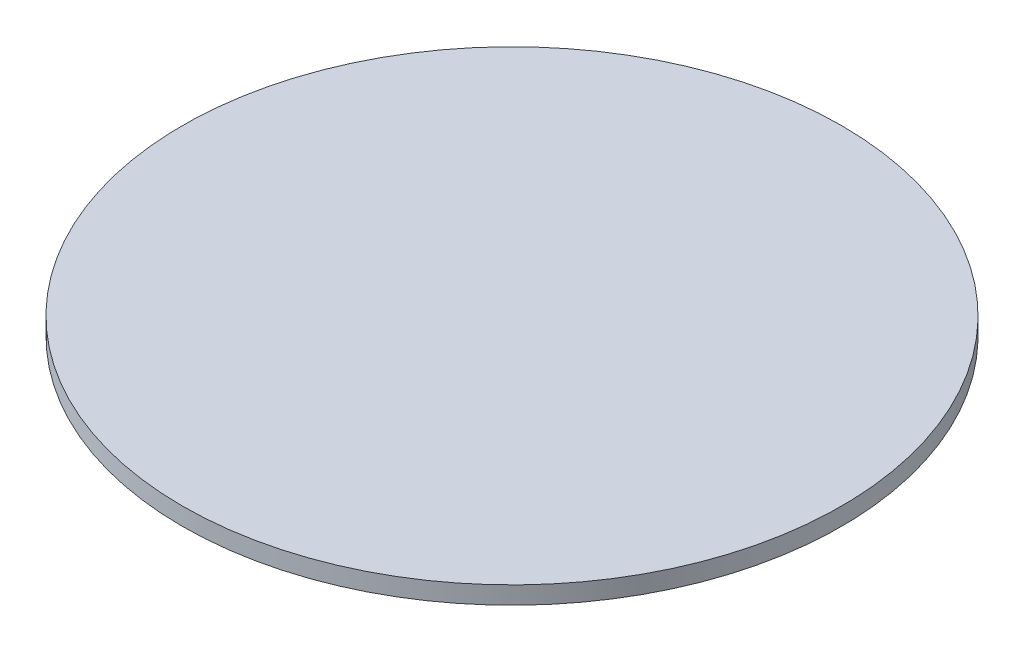
from build123d import *

# Parameters (mm, degrees)
SKETCH1_R                = 37.5
BOSS_EXTRUDE1_DEPTH      = 2
CUT_EXTRUDE1_OUTLINE_R   = 34.5
CUT_EXTRUDE1_OUTLINE_R_2 = 33.25
CUT_EXTRUDE1_OUTLINE_R_3 = 20.75
CUT_EXTRUDE1_OUTLINE_R_4 = 19.125
CUT_EXTRUDE1_OUTLINE_R_5 = 7
CUT_EXTRUDE1_OUTLINE_R_6 = 5.1
CUT_EXTRUDE1_DEPTH       = 0.4
SKETCH4_R                = 45.148665426
SKETCH4_R_2              = 37.375
CUT_EXTRUDE2_DEPTH       = 54.070707551


# Read off the part's stored shape, not the designer's step: Cut-Extrude1
with BuildPart() as part:
    # Sketch1 → Boss-Extrude1 (new body)
    with BuildSketch(Plane(origin=(0, 0, 0), x_dir=(1, 0, 0), z_dir=(0, 1, 0))):
        with Locations(Location((0, 0, 0), (0, 0, 270))):
            Circle(SKETCH1_R)
    extrude(amount=BOSS_EXTRUDE1_DEPTH)

    # Cut-Extrude1 outline → Cut-Extrude1 (cut)
    # profile 1 of 32: a face of its own
    with BuildSketch(Plane(origin=(0, 0, 0), x_dir=(1, 0, 0), z_dir=(0, 1, 0))):
        Circle(CUT_EXTRUDE1_OUTLINE_R)
        Circle(CUT_EXTRUDE1_OUTLINE_R_2, mode=Mode.SUBTRACT)
    # profile 2 of 32: a face of its own
    with BuildSketch(Plane(origin=(0, 0, 0), x_dir=(1, 0, 0), z_dir=(0, 1, 0))):
        with BuildLine():
            ThreePointArc((17.787271081, 14.244666107), (18.140824472, 14.098219498), (18.494377862, 14.244666107))
            add(Edge.make_bspline(
                [(18.494377862, 14.244666107), (18.773823334, 14.524111579), (19.892529947, 15.691578161), (21.619507812, 17.82365241), (23.140883452, 20.411675508), (23.625698704, 22.34072462), (23.249670965, 22.995112524)],
                knots=[0.045557158, 0.045557158, 0.045557158, 0.045557158, 0.155208161, 0.493865544, 0.798979995, 1, 1, 1, 1], degree=3))
            add(Edge.make_bspline(
                [(14.499224548, 18.239819421), (14.77867002, 18.519264892), (15.946136603, 19.637971506), (18.078210851, 21.364949371), (20.666233949, 22.886325011), (22.595283061, 23.371140262), (23.249670965, 22.995112524)],
                knots=[0.045557158, 0.045557158, 0.045557158, 0.045557158, 0.155208161, 0.493865544, 0.798979995, 1, 1, 1, 1], degree=3))
            ThreePointArc((14.499224548, 18.239819421), (14.352777939, 17.88626603), (14.499224548, 17.53271264))
            Line((14.499224548, 17.53271264), (15.436141033, 16.595796154))
            ThreePointArc((15.436141033, 16.595796154), (15.789694424, 16.449349545), (16.143247814, 16.595796154))
            Line((16.143247814, 16.595796154), (20.279822484, 20.732370824))
            ThreePointArc((20.279822484, 20.732370824), (20.986929265, 20.732370825), (20.986929266, 20.025264043))
            Line((20.986929266, 20.025264043), (16.850354596, 15.888689373))
            ThreePointArc((16.850354596, 15.888689373), (16.703907986, 15.535135982), (16.850354596, 15.181582592))
            Line((16.850354596, 15.181582592), (17.787271081, 14.244666107))
        make_face()
    # profile 3 of 32: a face of its own
    with BuildSketch(Plane(origin=(0, 0, 0), x_dir=(1, 0, 0), z_dir=(0, 1, 0))):
        with BuildLine():
            ThreePointArc((13.494393636, 18.362975396), (13.873803159, 18.313025184), (14.177406338, 18.545988098))
            add(Edge.make_bspline(
                [(14.177406338, 18.545988098), (14.375004126, 18.888237506), (15.153429151, 20.305466207), (16.269740251, 22.811866549), (17.069446606, 25.705465889), (17.038467529, 27.694263667), (16.505884573, 28.229030704)],
                knots=[0.045557158, 0.045557158, 0.045557158, 0.045557158, 0.155208161, 0.493865544, 0.798979995, 1, 1, 1, 1], degree=3))
            add(Edge.make_bspline(
                [(9.284362807, 21.370988098), (9.481960595, 21.713237506), (10.320104141, 23.095987702), (11.932554959, 25.315941645), (14.038632318, 27.455307333), (15.776471255, 28.422877555), (16.505884573, 28.229030704)],
                knots=[0.045557158, 0.045557158, 0.045557158, 0.045557158, 0.155208161, 0.493865544, 0.798979995, 1, 1, 1, 1], degree=3))
            ThreePointArc((9.284362807, 21.370988098), (9.234412596, 20.991578575), (9.467375509, 20.687975396))
            Line((9.467375509, 20.687975396), (10.614859169, 20.025475396))
            ThreePointArc((10.614859169, 20.025475396), (10.994268692, 19.975525184), (11.297871871, 20.208488098))
            Line((11.297871871, 20.208488098), (14.222871871, 25.27473671))
            ThreePointArc((14.222871871, 25.27473671), (14.905884573, 25.457749412), (15.088897275, 24.77473671))
            Line((15.088897275, 24.77473671), (12.163897275, 19.708488098))
            ThreePointArc((12.163897275, 19.708488098), (12.113947063, 19.329078575), (12.346909976, 19.025475396))
            Line((12.346909976, 19.025475396), (13.494393636, 18.362975396))
        make_face()
    # profile 4 of 32: a face of its own
    with BuildSketch(Plane(origin=(0, 0, 0), x_dir=(1, 0, 0), z_dir=(0, 1, 0))):
        with BuildLine():
            ThreePointArc((8.281895566, 21.229878257), (8.661305089, 21.279828469), (8.894268002, 21.583431648))
            add(Edge.make_bspline(
                [(8.894268002, 21.583431648), (8.996552144, 21.965161261), (9.381647199, 23.535570287), (9.811216778, 26.245489681), (9.834755182, 29.24747125), (9.290092949, 31.160484412), (8.637249424, 31.539187092)],
                knots=[0.045557158, 0.045557158, 0.045557158, 0.045557158, 0.155208161, 0.493865544, 0.798979995, 1, 1, 1, 1], degree=3))
            add(Edge.make_bspline(
                [(3.436787084, 23.045759253), (3.539071225, 23.427488866), (3.990773637, 24.980050504), (4.973715166, 27.541694332), (6.454321095, 30.153255833), (7.882519006, 31.537642713), (8.637249424, 31.539187092)],
                knots=[0.045557158, 0.045557158, 0.045557158, 0.045557158, 0.155208161, 0.493865544, 0.798979995, 1, 1, 1, 1], degree=3))
            ThreePointArc((3.436787084, 23.045759253), (3.486737295, 22.66634973), (3.790340474, 22.433386817))
            Line((3.790340474, 22.433386817), (5.070192194, 22.090451582))
            ThreePointArc((5.070192194, 22.090451582), (5.449601717, 22.140401794), (5.68256463, 22.444004973))
            Line((5.68256463, 22.444004973), (7.196656044, 28.094671057))
            ThreePointArc((7.196656044, 28.094671057), (7.809028479, 28.448224447), (8.16258187, 27.835852012))
            Line((8.16258187, 27.835852012), (6.648490456, 22.185185928))
            ThreePointArc((6.648490456, 22.185185928), (6.698440667, 21.805776405), (7.002043847, 21.572813492))
            Line((7.002043847, 21.572813492), (8.281895566, 21.229878257))
        make_face()
    # profile 5 of 32: a face of its own
    with BuildSketch(Plane(origin=(0, 0, 0), x_dir=(1, 0, 0), z_dir=(0, 1, 0))):
        with BuildLine():
            ThreePointArc((2.505, 22.65), (2.858553391, 22.796446609), (3.005, 23.15))
            add(Edge.make_bspline(
                [(3.005, 23.15), (3.005, 23.545195576), (2.970521495, 25.161764146), (2.684075096, 27.890526065), (1.929841445, 30.796309779), (0.908613888, 32.503169639), (0.18, 32.7)],
                knots=[0.045557158, 0.045557158, 0.045557158, 0.045557158, 0.155208161, 0.493865544, 0.798979995, 1, 1, 1, 1], degree=3))
            add(Edge.make_bspline(
                [(-2.645, 23.15), (-2.645, 23.545195576), (-2.610521495, 25.161764146), (-2.324075096, 27.890526065), (-1.569841445, 30.796309779), (-0.548613888, 32.503169639), (0.18, 32.7)],
                knots=[0.045557158, 0.045557158, 0.045557158, 0.045557158, 0.155208161, 0.493865544, 0.798979995, 1, 1, 1, 1], degree=3))
            ThreePointArc((-2.645, 23.15), (-2.498553391, 22.796446609), (-2.145, 22.65))
            Line((-2.145, 22.65), (-0.82, 22.65))
            ThreePointArc((-0.82, 22.65), (-0.466446609, 22.796446609), (-0.32, 23.15))
            Line((-0.32, 23.15), (-0.32, 29))
            ThreePointArc((-0.32, 29), (0.18, 29.5), (0.68, 29))
            Line((0.68, 29), (0.68, 23.15))
            ThreePointArc((0.68, 23.15), (0.826446609, 22.796446609), (1.18, 22.65))
            Line((1.18, 22.65), (2.505, 22.65))
        make_face()
    # profile 6 of 32: a face of its own
    with BuildSketch(Plane(origin=(0, 0, 0), x_dir=(1, 0, 0), z_dir=(0, 1, 0))):
        with BuildLine():
            ThreePointArc((22.526561673, 3.442607177), (22.759524586, 3.139003997), (23.138934109, 3.089053786))
            add(Edge.make_bspline(
                [(23.138934109, 3.089053786), (23.520663722, 3.191337928), (25.073225361, 3.64304034), (27.634869188, 4.625981869), (30.24643069, 6.106587798), (31.630817569, 7.534785708), (31.632361948, 8.289516126)],
                knots=[0.045557158, 0.045557158, 0.045557158, 0.045557158, 0.155208161, 0.493865544, 0.798979995, 1, 1, 1, 1], degree=3))
            add(Edge.make_bspline(
                [(21.676606504, 8.546534705), (22.058336118, 8.648818846), (23.628745143, 9.033913902), (26.338664538, 9.463483481), (29.340646106, 9.487021884), (31.253659268, 8.942359652), (31.632361948, 8.289516126)],
                knots=[0.045557158, 0.045557158, 0.045557158, 0.045557158, 0.155208161, 0.493865544, 0.798979995, 1, 1, 1, 1], degree=3))
            ThreePointArc((21.676606504, 8.546534705), (21.373003325, 8.313571792), (21.323053114, 7.934162269))
            Line((21.323053114, 7.934162269), (21.665988348, 6.654310549))
            ThreePointArc((21.665988348, 6.654310549), (21.898951262, 6.35070737), (22.278360784, 6.300757159))
            Line((22.278360784, 6.300757159), (27.929026868, 7.814848572))
            ThreePointArc((27.929026868, 7.814848572), (28.541399304, 7.461295182), (28.187845913, 6.848922746))
            Line((28.187845913, 6.848922746), (22.537179829, 5.334831332))
            ThreePointArc((22.537179829, 5.334831332), (22.23357665, 5.101868419), (22.183626439, 4.722458897))
            Line((22.183626439, 4.722458897), (22.526561673, 3.442607177))
        make_face()
    # profile 7 of 32: a face of its own
    with BuildSketch(Plane(origin=(0, 0, 0), x_dir=(1, 0, 0), z_dir=(0, 1, 0))):
        with BuildLine():
            ThreePointArc((20.867975396, 9.155606364), (21.171578575, 8.92264345), (21.550988098, 8.972593662))
            add(Edge.make_bspline(
                [(21.550988098, 8.972593662), (21.893237506, 9.17019145), (23.275987702, 10.008334996), (25.495941645, 11.620785814), (27.635307333, 13.726863173), (28.602877555, 15.46470211), (28.409030704, 16.194115427)],
                knots=[0.045557158, 0.045557158, 0.045557158, 0.045557158, 0.155208161, 0.493865544, 0.798979995, 1, 1, 1, 1], degree=3))
            add(Edge.make_bspline(
                [(18.725988098, 13.865637193), (19.068237506, 14.063234981), (20.485466207, 14.841660005), (22.991866549, 15.957971105), (25.885465889, 16.75767746), (27.874263667, 16.726698383), (28.409030704, 16.194115427)],
                knots=[0.045557158, 0.045557158, 0.045557158, 0.045557158, 0.155208161, 0.493865544, 0.798979995, 1, 1, 1, 1], degree=3))
            ThreePointArc((18.725988098, 13.865637193), (18.493025184, 13.562034014), (18.542975396, 13.182624491))
            Line((18.542975396, 13.182624491), (19.205475396, 12.035140831))
            ThreePointArc((19.205475396, 12.035140831), (19.509078575, 11.802177918), (19.888488098, 11.852128129))
            Line((19.888488098, 11.852128129), (24.95473671, 14.777128129))
            ThreePointArc((24.95473671, 14.777128129), (25.637749412, 14.594115427), (25.45473671, 13.911102725))
            Line((25.45473671, 13.911102725), (20.388488098, 10.986102725))
            ThreePointArc((20.388488098, 10.986102725), (20.155525184, 10.682499546), (20.205475396, 10.303090024))
            Line((20.205475396, 10.303090024), (20.867975396, 9.155606364))
        make_face()
    # profile 8 of 32: a face of its own
    with BuildSketch(Plane(origin=(0, 0, 0), x_dir=(1, 0, 0), z_dir=(0, 1, 0))):
        with BuildLine():
            ThreePointArc((22.65, -2.505), (22.796446609, -2.858553391), (23.15, -3.005))
            add(Edge.make_bspline(
                [(23.15, -3.005), (23.545195576, -3.005), (25.161764146, -2.970521495), (27.890526065, -2.684075096), (30.796309779, -1.929841445), (32.503169639, -0.908613888), (32.7, -0.18)],
                knots=[0.045557158, 0.045557158, 0.045557158, 0.045557158, 0.155208161, 0.493865544, 0.798979995, 1, 1, 1, 1], degree=3))
            add(Edge.make_bspline(
                [(23.15, 2.645), (23.545195576, 2.645), (25.161764146, 2.610521495), (27.890526065, 2.324075096), (30.796309779, 1.569841445), (32.503169639, 0.548613888), (32.7, -0.18)],
                knots=[0.045557158, 0.045557158, 0.045557158, 0.045557158, 0.155208161, 0.493865544, 0.798979995, 1, 1, 1, 1], degree=3))
            ThreePointArc((23.15, 2.645), (22.796446609, 2.498553391), (22.65, 2.145))
            Line((22.65, 2.145), (22.65, 0.82))
            ThreePointArc((22.65, 0.82), (22.796446609, 0.466446609), (23.15, 0.32))
            Line((23.15, 0.32), (29, 0.32))
            ThreePointArc((29, 0.32), (29.5, -0.18), (29, -0.68))
            Line((29, -0.68), (23.15, -0.68))
            ThreePointArc((23.15, -0.68), (22.796446609, -0.826446609), (22.65, -1.18))
            Line((22.65, -1.18), (22.65, -2.505))
        make_face()
    # profile 9 of 32: a face of its own
    with BuildSketch(Plane(origin=(0, 0, 0), x_dir=(1, 0, 0), z_dir=(0, 1, 0))):
        with BuildLine():
            ThreePointArc((21.229878257, -8.281895566), (21.279828469, -8.661305089), (21.583431648, -8.894268002))
            add(Edge.make_bspline(
                [(21.583431648, -8.894268002), (21.965161261, -8.996552144), (23.535570287, -9.381647199), (26.245489681, -9.811216778), (29.24747125, -9.834755182), (31.160484412, -9.290092949), (31.539187092, -8.637249424)],
                knots=[0.045557158, 0.045557158, 0.045557158, 0.045557158, 0.155208161, 0.493865544, 0.798979995, 1, 1, 1, 1], degree=3))
            add(Edge.make_bspline(
                [(23.045759253, -3.436787084), (23.427488866, -3.539071225), (24.980050504, -3.990773637), (27.541694332, -4.973715166), (30.153255833, -6.454321095), (31.537642713, -7.882519006), (31.539187092, -8.637249424)],
                knots=[0.045557158, 0.045557158, 0.045557158, 0.045557158, 0.155208161, 0.493865544, 0.798979995, 1, 1, 1, 1], degree=3))
            ThreePointArc((23.045759253, -3.436787084), (22.66634973, -3.486737295), (22.433386817, -3.790340474))
            Line((22.433386817, -3.790340474), (22.090451582, -5.070192194))
            ThreePointArc((22.090451582, -5.070192194), (22.140401794, -5.449601717), (22.444004973, -5.68256463))
            Line((22.444004973, -5.68256463), (28.094671057, -7.196656044))
            ThreePointArc((28.094671057, -7.196656044), (28.448224447, -7.809028479), (27.835852012, -8.16258187))
            Line((27.835852012, -8.16258187), (22.185185928, -6.648490456))
            ThreePointArc((22.185185928, -6.648490456), (21.805776405, -6.698440667), (21.572813492, -7.002043847))
            Line((21.572813492, -7.002043847), (21.229878257, -8.281895566))
        make_face()
    # profile 10 of 32: a face of its own
    with BuildSketch(Plane(origin=(0, 0, 0), x_dir=(1, 0, 0), z_dir=(0, 1, 0))):
        with BuildLine():
            ThreePointArc((-21.229878257, 8.281895566), (-21.279828469, 8.661305089), (-21.583431648, 8.894268002))
            add(Edge.make_bspline(
                [(-21.583431648, 8.894268002), (-21.965161261, 8.996552144), (-23.535570287, 9.381647199), (-26.245489681, 9.811216778), (-29.24747125, 9.834755182), (-31.160484412, 9.290092949), (-31.539187092, 8.637249424)],
                knots=[0.045557158, 0.045557158, 0.045557158, 0.045557158, 0.155208161, 0.493865544, 0.798979995, 1, 1, 1, 1], degree=3))
            add(Edge.make_bspline(
                [(-23.045759253, 3.436787084), (-23.427488866, 3.539071225), (-24.980050504, 3.990773637), (-27.541694332, 4.973715166), (-30.153255833, 6.454321095), (-31.537642713, 7.882519006), (-31.539187092, 8.637249424)],
                knots=[0.045557158, 0.045557158, 0.045557158, 0.045557158, 0.155208161, 0.493865544, 0.798979995, 1, 1, 1, 1], degree=3))
            ThreePointArc((-23.045759253, 3.436787084), (-22.66634973, 3.486737295), (-22.433386817, 3.790340474))
            Line((-22.433386817, 3.790340474), (-22.090451582, 5.070192194))
            ThreePointArc((-22.090451582, 5.070192194), (-22.140401794, 5.449601717), (-22.444004973, 5.68256463))
            Line((-22.444004973, 5.68256463), (-28.094671057, 7.196656044))
            ThreePointArc((-28.094671057, 7.196656044), (-28.448224447, 7.809028479), (-27.835852012, 8.16258187))
            Line((-27.835852012, 8.16258187), (-22.185185928, 6.648490456))
            ThreePointArc((-22.185185928, 6.648490456), (-21.805776405, 6.698440667), (-21.572813492, 7.002043847))
            Line((-21.572813492, 7.002043847), (-21.229878257, 8.281895566))
        make_face()
    # profile 11 of 32: a face of its own
    with BuildSketch(Plane(origin=(0, 0, 0), x_dir=(1, 0, 0), z_dir=(0, 1, 0))):
        with BuildLine():
            ThreePointArc((-22.65, 2.505), (-22.796446609, 2.858553391), (-23.15, 3.005))
            add(Edge.make_bspline(
                [(-23.15, 3.005), (-23.545195576, 3.005), (-25.161764146, 2.970521495), (-27.890526065, 2.684075096), (-30.796309779, 1.929841445), (-32.503169639, 0.908613888), (-32.7, 0.18)],
                knots=[0.045557158, 0.045557158, 0.045557158, 0.045557158, 0.155208161, 0.493865544, 0.798979995, 1, 1, 1, 1], degree=3))
            add(Edge.make_bspline(
                [(-23.15, -2.645), (-23.545195576, -2.645), (-25.161764146, -2.610521495), (-27.890526065, -2.324075096), (-30.796309779, -1.569841445), (-32.503169639, -0.548613888), (-32.7, 0.18)],
                knots=[0.045557158, 0.045557158, 0.045557158, 0.045557158, 0.155208161, 0.493865544, 0.798979995, 1, 1, 1, 1], degree=3))
            ThreePointArc((-23.15, -2.645), (-22.796446609, -2.498553391), (-22.65, -2.145))
            Line((-22.65, -2.145), (-22.65, -0.82))
            ThreePointArc((-22.65, -0.82), (-22.796446609, -0.466446609), (-23.15, -0.32))
            Line((-23.15, -0.32), (-29, -0.32))
            ThreePointArc((-29, -0.32), (-29.5, 0.18), (-29, 0.68))
            Line((-29, 0.68), (-23.15, 0.68))
            ThreePointArc((-23.15, 0.68), (-22.796446609, 0.826446609), (-22.65, 1.18))
            Line((-22.65, 1.18), (-22.65, 2.505))
        make_face()
    # profile 12 of 32: a face of its own
    with BuildSketch(Plane(origin=(0, 0, 0), x_dir=(1, 0, 0), z_dir=(0, 1, 0))):
        with BuildLine():
            ThreePointArc((-22.526561673, -3.442607177), (-22.759524586, -3.139003997), (-23.138934109, -3.089053786))
            add(Edge.make_bspline(
                [(-23.138934109, -3.089053786), (-23.520663722, -3.191337928), (-25.073225361, -3.64304034), (-27.634869188, -4.625981869), (-30.24643069, -6.106587798), (-31.630817569, -7.534785708), (-31.632361948, -8.289516126)],
                knots=[0.045557158, 0.045557158, 0.045557158, 0.045557158, 0.155208161, 0.493865544, 0.798979995, 1, 1, 1, 1], degree=3))
            add(Edge.make_bspline(
                [(-21.676606504, -8.546534705), (-22.058336118, -8.648818846), (-23.628745143, -9.033913902), (-26.338664538, -9.463483481), (-29.340646106, -9.487021884), (-31.253659268, -8.942359652), (-31.632361948, -8.289516126)],
                knots=[0.045557158, 0.045557158, 0.045557158, 0.045557158, 0.155208161, 0.493865544, 0.798979995, 1, 1, 1, 1], degree=3))
            ThreePointArc((-21.676606504, -8.546534705), (-21.373003325, -8.313571792), (-21.323053114, -7.934162269))
            Line((-21.323053114, -7.934162269), (-21.665988348, -6.654310549))
            ThreePointArc((-21.665988348, -6.654310549), (-21.898951262, -6.35070737), (-22.278360784, -6.300757159))
            Line((-22.278360784, -6.300757159), (-27.929026868, -7.814848572))
            ThreePointArc((-27.929026868, -7.814848572), (-28.541399304, -7.461295182), (-28.187845913, -6.848922746))
            Line((-28.187845913, -6.848922746), (-22.537179829, -5.334831332))
            ThreePointArc((-22.537179829, -5.334831332), (-22.23357665, -5.101868419), (-22.183626439, -4.722458897))
            Line((-22.183626439, -4.722458897), (-22.526561673, -3.442607177))
        make_face()
    # profile 13 of 32: a face of its own
    with BuildSketch(Plane(origin=(0, 0, 0), x_dir=(1, 0, 0), z_dir=(0, 1, 0))):
        with BuildLine():
            ThreePointArc((-9.155606364, 20.867975396), (-8.92264345, 21.171578575), (-8.972593662, 21.550988098))
            add(Edge.make_bspline(
                [(-8.972593662, 21.550988098), (-9.17019145, 21.893237506), (-10.008334996, 23.275987702), (-11.620785814, 25.495941645), (-13.726863173, 27.635307333), (-15.46470211, 28.602877555), (-16.194115427, 28.409030704)],
                knots=[0.045557158, 0.045557158, 0.045557158, 0.045557158, 0.155208161, 0.493865544, 0.798979995, 1, 1, 1, 1], degree=3))
            add(Edge.make_bspline(
                [(-13.865637193, 18.725988098), (-14.063234981, 19.068237506), (-14.841660005, 20.485466207), (-15.957971105, 22.991866549), (-16.75767746, 25.885465889), (-16.726698383, 27.874263667), (-16.194115427, 28.409030704)],
                knots=[0.045557158, 0.045557158, 0.045557158, 0.045557158, 0.155208161, 0.493865544, 0.798979995, 1, 1, 1, 1], degree=3))
            ThreePointArc((-13.865637193, 18.725988098), (-13.562034014, 18.493025184), (-13.182624491, 18.542975396))
            Line((-13.182624491, 18.542975396), (-12.035140831, 19.205475396))
            ThreePointArc((-12.035140831, 19.205475396), (-11.802177918, 19.509078575), (-11.852128129, 19.888488098))
            Line((-11.852128129, 19.888488098), (-14.777128129, 24.95473671))
            ThreePointArc((-14.777128129, 24.95473671), (-14.594115427, 25.637749412), (-13.911102725, 25.45473671))
            Line((-13.911102725, 25.45473671), (-10.986102725, 20.388488098))
            ThreePointArc((-10.986102725, 20.388488098), (-10.682499546, 20.155525184), (-10.303090024, 20.205475396))
            Line((-10.303090024, 20.205475396), (-9.155606364, 20.867975396))
        make_face()
    # profile 14 of 32: a face of its own
    with BuildSketch(Plane(origin=(0, 0, 0), x_dir=(1, 0, 0), z_dir=(0, 1, 0))):
        with BuildLine():
            ThreePointArc((-3.442607177, 22.526561673), (-3.139003997, 22.759524586), (-3.089053786, 23.138934109))
            add(Edge.make_bspline(
                [(-3.089053786, 23.138934109), (-3.191337928, 23.520663722), (-3.64304034, 25.073225361), (-4.625981869, 27.634869188), (-6.106587798, 30.24643069), (-7.534785708, 31.630817569), (-8.289516126, 31.632361948)],
                knots=[0.045557158, 0.045557158, 0.045557158, 0.045557158, 0.155208161, 0.493865544, 0.798979995, 1, 1, 1, 1], degree=3))
            add(Edge.make_bspline(
                [(-8.546534705, 21.676606504), (-8.648818846, 22.058336118), (-9.033913902, 23.628745143), (-9.463483481, 26.338664538), (-9.487021884, 29.340646106), (-8.942359652, 31.253659268), (-8.289516126, 31.632361948)],
                knots=[0.045557158, 0.045557158, 0.045557158, 0.045557158, 0.155208161, 0.493865544, 0.798979995, 1, 1, 1, 1], degree=3))
            ThreePointArc((-8.546534705, 21.676606504), (-8.313571792, 21.373003325), (-7.934162269, 21.323053114))
            Line((-7.934162269, 21.323053114), (-6.654310549, 21.665988348))
            ThreePointArc((-6.654310549, 21.665988348), (-6.35070737, 21.898951262), (-6.300757159, 22.278360784))
            Line((-6.300757159, 22.278360784), (-7.814848572, 27.929026868))
            ThreePointArc((-7.814848572, 27.929026868), (-7.461295182, 28.541399304), (-6.848922746, 28.187845913))
            Line((-6.848922746, 28.187845913), (-5.334831332, 22.537179829))
            ThreePointArc((-5.334831332, 22.537179829), (-5.101868419, 22.23357665), (-4.722458897, 22.183626439))
            Line((-4.722458897, 22.183626439), (-3.442607177, 22.526561673))
        make_face()
    # profile 15 of 32: a face of its own
    with BuildSketch(Plane(origin=(0, 0, 0), x_dir=(1, 0, 0), z_dir=(0, 1, 0))):
        with BuildLine():
            ThreePointArc((-18.362975396, 13.494393636), (-18.313025184, 13.873803159), (-18.545988098, 14.177406338))
            add(Edge.make_bspline(
                [(-18.545988098, 14.177406338), (-18.888237506, 14.375004126), (-20.305466207, 15.153429151), (-22.811866549, 16.269740251), (-25.705465889, 17.069446606), (-27.694263667, 17.038467529), (-28.229030704, 16.505884573)],
                knots=[0.045557158, 0.045557158, 0.045557158, 0.045557158, 0.155208161, 0.493865544, 0.798979995, 1, 1, 1, 1], degree=3))
            add(Edge.make_bspline(
                [(-21.370988098, 9.284362807), (-21.713237506, 9.481960595), (-23.095987702, 10.320104141), (-25.315941645, 11.932554959), (-27.455307333, 14.038632318), (-28.422877555, 15.776471255), (-28.229030704, 16.505884573)],
                knots=[0.045557158, 0.045557158, 0.045557158, 0.045557158, 0.155208161, 0.493865544, 0.798979995, 1, 1, 1, 1], degree=3))
            ThreePointArc((-21.370988098, 9.284362807), (-20.991578575, 9.234412596), (-20.687975396, 9.467375509))
            Line((-20.687975396, 9.467375509), (-20.025475396, 10.614859169))
            ThreePointArc((-20.025475396, 10.614859169), (-19.975525184, 10.994268692), (-20.208488098, 11.297871871))
            Line((-20.208488098, 11.297871871), (-25.27473671, 14.222871871))
            ThreePointArc((-25.27473671, 14.222871871), (-25.457749412, 14.905884573), (-24.77473671, 15.088897275))
            Line((-24.77473671, 15.088897275), (-19.708488098, 12.163897275))
            ThreePointArc((-19.708488098, 12.163897275), (-19.329078575, 12.113947063), (-19.025475396, 12.346909976))
            Line((-19.025475396, 12.346909976), (-18.362975396, 13.494393636))
        make_face()
    # profile 16 of 32: a face of its own
    with BuildSketch(Plane(origin=(0, 0, 0), x_dir=(1, 0, 0), z_dir=(0, 1, 0))):
        with BuildLine():
            ThreePointArc((-14.244666107, 17.787271081), (-14.098219498, 18.140824472), (-14.244666107, 18.494377862))
            add(Edge.make_bspline(
                [(-14.244666107, 18.494377862), (-14.524111579, 18.773823334), (-15.691578161, 19.892529947), (-17.82365241, 21.619507812), (-20.411675508, 23.140883452), (-22.34072462, 23.625698704), (-22.995112524, 23.249670965)],
                knots=[0.045557158, 0.045557158, 0.045557158, 0.045557158, 0.155208161, 0.493865544, 0.798979995, 1, 1, 1, 1], degree=3))
            add(Edge.make_bspline(
                [(-18.239819421, 14.499224548), (-18.519264892, 14.77867002), (-19.637971506, 15.946136603), (-21.364949371, 18.078210851), (-22.886325011, 20.666233949), (-23.371140262, 22.595283061), (-22.995112524, 23.249670965)],
                knots=[0.045557158, 0.045557158, 0.045557158, 0.045557158, 0.155208161, 0.493865544, 0.798979995, 1, 1, 1, 1], degree=3))
            ThreePointArc((-18.239819421, 14.499224548), (-17.88626603, 14.352777939), (-17.53271264, 14.499224548))
            Line((-17.53271264, 14.499224548), (-16.595796154, 15.436141033))
            ThreePointArc((-16.595796154, 15.436141033), (-16.449349545, 15.789694424), (-16.595796154, 16.143247814))
            Line((-16.595796154, 16.143247814), (-20.732370824, 20.279822484))
            ThreePointArc((-20.732370824, 20.279822484), (-20.732370825, 20.986929265), (-20.025264043, 20.986929266))
            Line((-20.025264043, 20.986929266), (-15.888689373, 16.850354596))
            ThreePointArc((-15.888689373, 16.850354596), (-15.535135982, 16.703907986), (-15.181582592, 16.850354596))
            Line((-15.181582592, 16.850354596), (-14.244666107, 17.787271081))
        make_face()
    # profile 17 of 32: a face of its own
    with BuildSketch(Plane(origin=(0, 0, 0), x_dir=(1, 0, 0), z_dir=(0, 1, 0))):
        with BuildLine():
            ThreePointArc((-2.505, -22.65), (-2.858553391, -22.796446609), (-3.005, -23.15))
            add(Edge.make_bspline(
                [(-3.005, -23.15), (-3.005, -23.545195576), (-2.970521495, -25.161764146), (-2.684075096, -27.890526065), (-1.929841445, -30.796309779), (-0.908613888, -32.503169639), (-0.18, -32.7)],
                knots=[0.045557158, 0.045557158, 0.045557158, 0.045557158, 0.155208161, 0.493865544, 0.798979995, 1, 1, 1, 1], degree=3))
            add(Edge.make_bspline(
                [(2.645, -23.15), (2.645, -23.545195576), (2.610521495, -25.161764146), (2.324075096, -27.890526065), (1.569841445, -30.796309779), (0.548613888, -32.503169639), (-0.18, -32.7)],
                knots=[0.045557158, 0.045557158, 0.045557158, 0.045557158, 0.155208161, 0.493865544, 0.798979995, 1, 1, 1, 1], degree=3))
            ThreePointArc((2.645, -23.15), (2.498553391, -22.796446609), (2.145, -22.65))
            Line((2.145, -22.65), (0.82, -22.65))
            ThreePointArc((0.82, -22.65), (0.466446609, -22.796446609), (0.32, -23.15))
            Line((0.32, -23.15), (0.32, -29))
            ThreePointArc((0.32, -29), (-0.18, -29.5), (-0.68, -29))
            Line((-0.68, -29), (-0.68, -23.15))
            ThreePointArc((-0.68, -23.15), (-0.826446609, -22.796446609), (-1.18, -22.65))
            Line((-1.18, -22.65), (-2.505, -22.65))
        make_face()
    # profile 18 of 32: a face of its own
    with BuildSketch(Plane(origin=(0, 0, 0), x_dir=(1, 0, 0), z_dir=(0, 1, 0))):
        with BuildLine():
            ThreePointArc((-8.281895566, -21.229878257), (-8.661305089, -21.279828469), (-8.894268002, -21.583431648))
            add(Edge.make_bspline(
                [(-8.894268002, -21.583431648), (-8.996552144, -21.965161261), (-9.381647199, -23.535570287), (-9.811216778, -26.245489681), (-9.834755182, -29.24747125), (-9.290092949, -31.160484412), (-8.637249424, -31.539187092)],
                knots=[0.045557158, 0.045557158, 0.045557158, 0.045557158, 0.155208161, 0.493865544, 0.798979995, 1, 1, 1, 1], degree=3))
            add(Edge.make_bspline(
                [(-3.436787084, -23.045759253), (-3.539071225, -23.427488866), (-3.990773637, -24.980050504), (-4.973715166, -27.541694332), (-6.454321095, -30.153255833), (-7.882519006, -31.537642713), (-8.637249424, -31.539187092)],
                knots=[0.045557158, 0.045557158, 0.045557158, 0.045557158, 0.155208161, 0.493865544, 0.798979995, 1, 1, 1, 1], degree=3))
            ThreePointArc((-3.436787084, -23.045759253), (-3.486737295, -22.66634973), (-3.790340474, -22.433386817))
            Line((-3.790340474, -22.433386817), (-5.070192194, -22.090451582))
            ThreePointArc((-5.070192194, -22.090451582), (-5.449601717, -22.140401794), (-5.68256463, -22.444004973))
            Line((-5.68256463, -22.444004973), (-7.196656044, -28.094671057))
            ThreePointArc((-7.196656044, -28.094671057), (-7.809028479, -28.448224447), (-8.16258187, -27.835852012))
            Line((-8.16258187, -27.835852012), (-6.648490456, -22.185185928))
            ThreePointArc((-6.648490456, -22.185185928), (-6.698440667, -21.805776405), (-7.002043847, -21.572813492))
            Line((-7.002043847, -21.572813492), (-8.281895566, -21.229878257))
        make_face()
    # profile 19 of 32: a face of its own
    with BuildSketch(Plane(origin=(0, 0, 0), x_dir=(1, 0, 0), z_dir=(0, 1, 0))):
        with BuildLine():
            ThreePointArc((-17.787271081, -14.244666107), (-18.140824472, -14.098219498), (-18.494377862, -14.244666107))
            add(Edge.make_bspline(
                [(-18.494377862, -14.244666107), (-18.773823334, -14.524111579), (-19.892529947, -15.691578161), (-21.619507812, -17.82365241), (-23.140883452, -20.411675508), (-23.625698704, -22.34072462), (-23.249670965, -22.995112524)],
                knots=[0.045557158, 0.045557158, 0.045557158, 0.045557158, 0.155208161, 0.493865544, 0.798979995, 1, 1, 1, 1], degree=3))
            add(Edge.make_bspline(
                [(-14.499224548, -18.239819421), (-14.77867002, -18.519264892), (-15.946136603, -19.637971506), (-18.078210851, -21.364949371), (-20.666233949, -22.886325011), (-22.595283061, -23.371140262), (-23.249670965, -22.995112524)],
                knots=[0.045557158, 0.045557158, 0.045557158, 0.045557158, 0.155208161, 0.493865544, 0.798979995, 1, 1, 1, 1], degree=3))
            ThreePointArc((-14.499224548, -18.239819421), (-14.352777939, -17.88626603), (-14.499224548, -17.53271264))
            Line((-14.499224548, -17.53271264), (-15.436141033, -16.595796154))
            ThreePointArc((-15.436141033, -16.595796154), (-15.789694424, -16.449349545), (-16.143247814, -16.595796154))
            Line((-16.143247814, -16.595796154), (-20.279822484, -20.732370824))
            ThreePointArc((-20.279822484, -20.732370824), (-20.986929265, -20.732370825), (-20.986929266, -20.025264043))
            Line((-20.986929266, -20.025264043), (-16.850354596, -15.888689373))
            ThreePointArc((-16.850354596, -15.888689373), (-16.703907986, -15.535135982), (-16.850354596, -15.181582592))
            Line((-16.850354596, -15.181582592), (-17.787271081, -14.244666107))
        make_face()
    # profile 20 of 32: a face of its own
    with BuildSketch(Plane(origin=(0, 0, 0), x_dir=(1, 0, 0), z_dir=(0, 1, 0))):
        with BuildLine():
            ThreePointArc((-13.494393636, -18.362975396), (-13.873803159, -18.313025184), (-14.177406338, -18.545988098))
            add(Edge.make_bspline(
                [(-14.177406338, -18.545988098), (-14.375004126, -18.888237506), (-15.153429151, -20.305466207), (-16.269740251, -22.811866549), (-17.069446606, -25.705465889), (-17.038467529, -27.694263667), (-16.505884573, -28.229030704)],
                knots=[0.045557158, 0.045557158, 0.045557158, 0.045557158, 0.155208161, 0.493865544, 0.798979995, 1, 1, 1, 1], degree=3))
            add(Edge.make_bspline(
                [(-9.284362807, -21.370988098), (-9.481960595, -21.713237506), (-10.320104141, -23.095987702), (-11.932554959, -25.315941645), (-14.038632318, -27.455307333), (-15.776471255, -28.422877555), (-16.505884573, -28.229030704)],
                knots=[0.045557158, 0.045557158, 0.045557158, 0.045557158, 0.155208161, 0.493865544, 0.798979995, 1, 1, 1, 1], degree=3))
            ThreePointArc((-9.284362807, -21.370988098), (-9.234412596, -20.991578575), (-9.467375509, -20.687975396))
            Line((-9.467375509, -20.687975396), (-10.614859169, -20.025475396))
            ThreePointArc((-10.614859169, -20.025475396), (-10.994268692, -19.975525184), (-11.297871871, -20.208488098))
            Line((-11.297871871, -20.208488098), (-14.222871871, -25.27473671))
            ThreePointArc((-14.222871871, -25.27473671), (-14.905884573, -25.457749412), (-15.088897275, -24.77473671))
            Line((-15.088897275, -24.77473671), (-12.163897275, -19.708488098))
            ThreePointArc((-12.163897275, -19.708488098), (-12.113947063, -19.329078575), (-12.346909976, -19.025475396))
            Line((-12.346909976, -19.025475396), (-13.494393636, -18.362975396))
        make_face()
    # profile 21 of 32: a face of its own
    with BuildSketch(Plane(origin=(0, 0, 0), x_dir=(1, 0, 0), z_dir=(0, 1, 0))):
        with BuildLine():
            ThreePointArc((14.244666107, -17.787271081), (14.098219498, -18.140824472), (14.244666107, -18.494377862))
            add(Edge.make_bspline(
                [(14.244666107, -18.494377862), (14.524111579, -18.773823334), (15.691578161, -19.892529947), (17.82365241, -21.619507812), (20.411675508, -23.140883452), (22.34072462, -23.625698704), (22.995112524, -23.249670965)],
                knots=[0.045557158, 0.045557158, 0.045557158, 0.045557158, 0.155208161, 0.493865544, 0.798979995, 1, 1, 1, 1], degree=3))
            add(Edge.make_bspline(
                [(18.239819421, -14.499224548), (18.519264892, -14.77867002), (19.637971506, -15.946136603), (21.364949371, -18.078210851), (22.886325011, -20.666233949), (23.371140262, -22.595283061), (22.995112524, -23.249670965)],
                knots=[0.045557158, 0.045557158, 0.045557158, 0.045557158, 0.155208161, 0.493865544, 0.798979995, 1, 1, 1, 1], degree=3))
            ThreePointArc((18.239819421, -14.499224548), (17.88626603, -14.352777939), (17.53271264, -14.499224548))
            Line((17.53271264, -14.499224548), (16.595796154, -15.436141033))
            ThreePointArc((16.595796154, -15.436141033), (16.449349545, -15.789694424), (16.595796154, -16.143247814))
            Line((16.595796154, -16.143247814), (20.732370824, -20.279822484))
            ThreePointArc((20.732370824, -20.279822484), (20.732370825, -20.986929265), (20.025264043, -20.986929266))
            Line((20.025264043, -20.986929266), (15.888689373, -16.850354596))
            ThreePointArc((15.888689373, -16.850354596), (15.535135982, -16.703907986), (15.181582592, -16.850354596))
            Line((15.181582592, -16.850354596), (14.244666107, -17.787271081))
        make_face()
    # profile 22 of 32: a face of its own
    with BuildSketch(Plane(origin=(0, 0, 0), x_dir=(1, 0, 0), z_dir=(0, 1, 0))):
        with BuildLine():
            ThreePointArc((18.362975396, -13.494393636), (18.313025184, -13.873803159), (18.545988098, -14.177406338))
            add(Edge.make_bspline(
                [(18.545988098, -14.177406338), (18.888237506, -14.375004126), (20.305466207, -15.153429151), (22.811866549, -16.269740251), (25.705465889, -17.069446606), (27.694263667, -17.038467529), (28.229030704, -16.505884573)],
                knots=[0.045557158, 0.045557158, 0.045557158, 0.045557158, 0.155208161, 0.493865544, 0.798979995, 1, 1, 1, 1], degree=3))
            add(Edge.make_bspline(
                [(21.370988098, -9.284362807), (21.713237506, -9.481960595), (23.095987702, -10.320104141), (25.315941645, -11.932554959), (27.455307333, -14.038632318), (28.422877555, -15.776471255), (28.229030704, -16.505884573)],
                knots=[0.045557158, 0.045557158, 0.045557158, 0.045557158, 0.155208161, 0.493865544, 0.798979995, 1, 1, 1, 1], degree=3))
            ThreePointArc((21.370988098, -9.284362807), (20.991578575, -9.234412596), (20.687975396, -9.467375509))
            Line((20.687975396, -9.467375509), (20.025475396, -10.614859169))
            ThreePointArc((20.025475396, -10.614859169), (19.975525184, -10.994268692), (20.208488098, -11.297871871))
            Line((20.208488098, -11.297871871), (25.27473671, -14.222871871))
            ThreePointArc((25.27473671, -14.222871871), (25.457749412, -14.905884573), (24.77473671, -15.088897275))
            Line((24.77473671, -15.088897275), (19.708488098, -12.163897275))
            ThreePointArc((19.708488098, -12.163897275), (19.329078575, -12.113947063), (19.025475396, -12.346909976))
            Line((19.025475396, -12.346909976), (18.362975396, -13.494393636))
        make_face()
    # profile 23 of 32: a face of its own
    with BuildSketch(Plane(origin=(0, 0, 0), x_dir=(1, 0, 0), z_dir=(0, 1, 0))):
        with BuildLine():
            ThreePointArc((3.442607177, -22.526561673), (3.139003997, -22.759524586), (3.089053786, -23.138934109))
            add(Edge.make_bspline(
                [(3.089053786, -23.138934109), (3.191337928, -23.520663722), (3.64304034, -25.073225361), (4.625981869, -27.634869188), (6.106587798, -30.24643069), (7.534785708, -31.630817569), (8.289516126, -31.632361948)],
                knots=[0.045557158, 0.045557158, 0.045557158, 0.045557158, 0.155208161, 0.493865544, 0.798979995, 1, 1, 1, 1], degree=3))
            add(Edge.make_bspline(
                [(8.546534705, -21.676606504), (8.648818846, -22.058336118), (9.033913902, -23.628745143), (9.463483481, -26.338664538), (9.487021884, -29.340646106), (8.942359652, -31.253659268), (8.289516126, -31.632361948)],
                knots=[0.045557158, 0.045557158, 0.045557158, 0.045557158, 0.155208161, 0.493865544, 0.798979995, 1, 1, 1, 1], degree=3))
            ThreePointArc((8.546534705, -21.676606504), (8.313571792, -21.373003325), (7.934162269, -21.323053114))
            Line((7.934162269, -21.323053114), (6.654310549, -21.665988348))
            ThreePointArc((6.654310549, -21.665988348), (6.35070737, -21.898951262), (6.300757159, -22.278360784))
            Line((6.300757159, -22.278360784), (7.814848572, -27.929026868))
            ThreePointArc((7.814848572, -27.929026868), (7.461295182, -28.541399304), (6.848922746, -28.187845913))
            Line((6.848922746, -28.187845913), (5.334831332, -22.537179829))
            ThreePointArc((5.334831332, -22.537179829), (5.101868419, -22.23357665), (4.722458897, -22.183626439))
            Line((4.722458897, -22.183626439), (3.442607177, -22.526561673))
        make_face()
    # profile 24 of 32: a face of its own
    with BuildSketch(Plane(origin=(0, 0, 0), x_dir=(1, 0, 0), z_dir=(0, 1, 0))):
        with BuildLine():
            ThreePointArc((9.155606364, -20.867975396), (8.92264345, -21.171578575), (8.972593662, -21.550988098))
            add(Edge.make_bspline(
                [(8.972593662, -21.550988098), (9.17019145, -21.893237506), (10.008334996, -23.275987702), (11.620785814, -25.495941645), (13.726863173, -27.635307333), (15.46470211, -28.602877555), (16.194115427, -28.409030704)],
                knots=[0.045557158, 0.045557158, 0.045557158, 0.045557158, 0.155208161, 0.493865544, 0.798979995, 1, 1, 1, 1], degree=3))
            add(Edge.make_bspline(
                [(13.865637193, -18.725988098), (14.063234981, -19.068237506), (14.841660005, -20.485466207), (15.957971105, -22.991866549), (16.75767746, -25.885465889), (16.726698383, -27.874263667), (16.194115427, -28.409030704)],
                knots=[0.045557158, 0.045557158, 0.045557158, 0.045557158, 0.155208161, 0.493865544, 0.798979995, 1, 1, 1, 1], degree=3))
            ThreePointArc((13.865637193, -18.725988098), (13.562034014, -18.493025184), (13.182624491, -18.542975396))
            Line((13.182624491, -18.542975396), (12.035140831, -19.205475396))
            ThreePointArc((12.035140831, -19.205475396), (11.802177918, -19.509078575), (11.852128129, -19.888488098))
            Line((11.852128129, -19.888488098), (14.777128129, -24.95473671))
            ThreePointArc((14.777128129, -24.95473671), (14.594115427, -25.637749412), (13.911102725, -25.45473671))
            Line((13.911102725, -25.45473671), (10.986102725, -20.388488098))
            ThreePointArc((10.986102725, -20.388488098), (10.682499546, -20.155525184), (10.303090024, -20.205475396))
            Line((10.303090024, -20.205475396), (9.155606364, -20.867975396))
        make_face()
    # profile 25 of 32: a face of its own
    with BuildSketch(Plane(origin=(0, 0, 0), x_dir=(1, 0, 0), z_dir=(0, 1, 0))):
        with BuildLine():
            ThreePointArc((-20.867975396, -9.155606364), (-21.171578575, -8.92264345), (-21.550988098, -8.972593662))
            add(Edge.make_bspline(
                [(-21.550988098, -8.972593662), (-21.893237506, -9.17019145), (-23.275987702, -10.008334996), (-25.495941645, -11.620785814), (-27.635307333, -13.726863173), (-28.602877555, -15.46470211), (-28.409030704, -16.194115427)],
                knots=[0.045557158, 0.045557158, 0.045557158, 0.045557158, 0.155208161, 0.493865544, 0.798979995, 1, 1, 1, 1], degree=3))
            add(Edge.make_bspline(
                [(-18.725988098, -13.865637193), (-19.068237506, -14.063234981), (-20.485466207, -14.841660005), (-22.991866549, -15.957971105), (-25.885465889, -16.75767746), (-27.874263667, -16.726698383), (-28.409030704, -16.194115427)],
                knots=[0.045557158, 0.045557158, 0.045557158, 0.045557158, 0.155208161, 0.493865544, 0.798979995, 1, 1, 1, 1], degree=3))
            ThreePointArc((-18.725988098, -13.865637193), (-18.493025184, -13.562034014), (-18.542975396, -13.182624491))
            Line((-18.542975396, -13.182624491), (-19.205475396, -12.035140831))
            ThreePointArc((-19.205475396, -12.035140831), (-19.509078575, -11.802177918), (-19.888488098, -11.852128129))
            Line((-19.888488098, -11.852128129), (-24.95473671, -14.777128129))
            ThreePointArc((-24.95473671, -14.777128129), (-25.637749412, -14.594115427), (-25.45473671, -13.911102725))
            Line((-25.45473671, -13.911102725), (-20.388488098, -10.986102725))
            ThreePointArc((-20.388488098, -10.986102725), (-20.155525184, -10.682499546), (-20.205475396, -10.303090024))
            Line((-20.205475396, -10.303090024), (-20.867975396, -9.155606364))
        make_face()
    # profile 26 of 32: a face of its own
    with BuildSketch(Plane(origin=(0, 0, 0), x_dir=(1, 0, 0), z_dir=(0, 1, 0))):
        Circle(CUT_EXTRUDE1_OUTLINE_R_3)
        Circle(CUT_EXTRUDE1_OUTLINE_R_4, mode=Mode.SUBTRACT)
    # profile 27 of 32: a face of its own
    with BuildSketch(Plane(origin=(0, 0, 0), x_dir=(1, 0, 0), z_dir=(0, 1, 0))):
        with BuildLine():
            ThreePointArc((6.204425411, 9.980045178), (6.519885642, 10.408422387), (6.81211793, 10.852969887))
            Line((6.81211793, 10.852969887), (7.318822352, 11.67034426))
            ThreePointArc((7.318822352, 11.67034426), (7.381529561, 11.823453898), (7.39083691, 11.988645085))
            ThreePointArc((7.39083691, 11.988645085), (8.082928526, 13.340477064), (9.598053982, 13.236384046))
            ThreePointArc((9.598053982, 13.236384046), (10.145899606, 11.819942845), (9.059460239, 10.758768963))
            ThreePointArc((9.059460239, 10.758768963), (8.904424141, 10.700988661), (8.776732546, 10.59577644))
            Line((8.776732546, 10.59577644), (8.145940209, 9.86986235))
            ThreePointArc((8.145940209, 9.86986235), (7.807797185, 9.459153834), (7.491974563, 9.03104373))
            Line((7.491974563, 9.03104373), (5.195162215, 5.737716427))
            ThreePointArc((5.195162215, 5.737716427), (5.234457094, 5.268422995), (5.702935083, 5.220373162))
            Line((5.702935083, 5.220373162), (10.155124076, 8.203405632))
            ThreePointArc((10.155124076, 8.203405632), (10.286742404, 8.245600896), (10.420664733, 8.211415605))
            ThreePointArc((10.420664733, 8.211415605), (10.643591852, 8.015612938), (10.777616107, 7.750900483))
            ThreePointArc((10.777616107, 7.750900483), (10.775105908, 7.605443783), (10.692039492, 7.486012115))
            Line((10.692039492, 7.486012115), (6.655897648, 4.302392379))
            ThreePointArc((6.655897648, 4.302392379), (6.480039883, 4.029310715), (6.509067148, 3.705803425))
            Line((6.509067148, 3.705803425), (6.727270107, 3.21757291))
            ThreePointArc((6.727270107, 3.21757291), (6.99045577, 2.960463392), (7.358310357, 2.95304714))
            Line((7.358310357, 2.95304714), (13.22662951, 5.139303332))
            ThreePointArc((13.22662951, 5.139303332), (14.39558022, 6.340934968), (14.53072176, 8.011893111))
            ThreePointArc((14.53072176, 8.011893111), (13.330380192, 11.791053673), (10.755009059, 14.806072407))
            ThreePointArc((10.755009059, 14.806072407), (7.112855971, 16.37374435), (3.14774746, 16.401832312))
            ThreePointArc((3.14774746, 16.401832312), (1.591643913, 15.778208945), (0.789807011, 14.305992272))
            Line((0.789807011, 14.305992272), (0.438279492, 8.053527621))
            ThreePointArc((0.438279492, 8.053527621), (0.554233596, 7.704347662), (0.877717049, 7.529046627))
            Line((0.877717049, 7.529046627), (1.408654322, 7.465115568))
            ThreePointArc((1.408654322, 7.465115568), (1.726259531, 7.5331338), (1.935060468, 7.781934358))
            Line((1.935060468, 7.781934358), (3.781520565, 12.579481723))
            ThreePointArc((3.781520565, 12.579481723), (3.871017446, 12.69417375), (4.009214836, 12.7396208))
            ThreePointArc((4.009214836, 12.7396208), (4.301734058, 12.689944963), (4.554742276, 12.534954556))
            ThreePointArc((4.554742276, 12.534954556), (4.627031682, 12.417149351), (4.625680454, 12.278939371))
            Line((4.625680454, 12.278939371), (3.093954552, 7.143349307))
            ThreePointArc((3.093954552, 7.143349307), (3.278502333, 6.710079727), (3.738401331, 6.811437136))
            Line((3.738401331, 6.811437136), (6.204425411, 9.980045178))
        make_face()
    # profile 28 of 32: a face of its own
    with BuildSketch(Plane(origin=(0, 0, 0), x_dir=(1, 0, 0), z_dir=(0, 1, 0))):
        with BuildLine():
            ThreePointArc((-7.574314107, 8.984762782), (-7.884242471, 9.417159127), (-8.216727524, 9.832461282))
            Line((-8.216727524, 9.832461282), (-8.837516471, 10.566948396))
            ThreePointArc((-8.837516471, 10.566948396), (-8.963754796, 10.673899976), (-9.117984822, 10.733798675))
            ThreePointArc((-9.117984822, 10.733798675), (-10.189785364, 11.809755971), (-9.622587506, 13.218559398))
            ThreePointArc((-9.622587506, 13.218559398), (-8.106178263, 13.301887146), (-7.432670156, 11.940701143))
            ThreePointArc((-7.432670156, 11.940701143), (-7.425626612, 11.775397956), (-7.365022716, 11.621443668))
            Line((-7.365022716, 11.621443668), (-6.869562943, 10.797204715))
            ThreePointArc((-6.869562943, 10.797204715), (-6.583447873, 10.348695678), (-6.273885527, 9.916037217))
            Line((-6.273885527, 9.916037217), (-3.851499183, 6.713944762))
            ThreePointArc((-3.851499183, 6.713944762), (-3.393031821, 6.606296768), (-3.202566054, 7.036997597))
            Line((-3.202566054, 7.036997597), (-4.663796462, 12.193088679))
            ThreePointArc((-4.663796462, 12.193088679), (-4.663254244, 12.331304201), (-4.589357823, 12.448108069))
            ThreePointArc((-4.589357823, 12.448108069), (-4.334250153, 12.599618006), (-4.041077876, 12.645282))
            ThreePointArc((-4.041077876, 12.645282), (-3.903516027, 12.597946066), (-3.815598695, 12.482038795))
            Line((-3.815598695, 12.482038795), (-2.035032822, 7.659647191))
            ThreePointArc((-2.035032822, 7.659647191), (-1.829659764, 7.408009643), (-1.51301613, 7.335646962))
            Line((-1.51301613, 7.335646962), (-0.981252894, 7.392298782))
            ThreePointArc((-0.981252894, 7.392298782), (-0.655398368, 7.563152012), (-0.534671775, 7.910710766))
            Line((-0.534671775, 7.910710766), (-0.800514626, 14.167404252))
            ThreePointArc((-0.800514626, 14.167404252), (-1.582108589, 15.650467039), (-3.129523186, 16.295348745))
            ThreePointArc((-3.129523186, 16.295348745), (-7.094644409, 16.321580913), (-10.75793107, 14.803949443))
            ThreePointArc((-10.75793107, 14.803949443), (-13.374362887, 11.824493287), (-14.62636204, 8.062130657))
            ThreePointArc((-14.62636204, 8.062130657), (-14.514123415, 6.38947802), (-13.361743384, 5.171945838))
            Line((-13.361743384, 5.171945838), (-7.523924111, 2.905505466))
            ThreePointArc((-7.523924111, 2.905505466), (-7.156002448, 2.907881831), (-6.889319371, 3.161361878))
            Line((-6.889319371, 3.161361878), (-6.664448681, 3.646557448))
            ThreePointArc((-6.664448681, 3.646557448), (-6.630992457, 3.969636741), (-6.803092811, 4.245101833))
            Line((-6.803092811, 4.245101833), (-10.795243945, 7.483713408))
            ThreePointArc((-10.795243945, 7.483713408), (-10.876666488, 7.604271785), (-10.877183859, 7.749749224))
            ThreePointArc((-10.877183859, 7.749749224), (-10.739545919, 8.012600859), (-10.513957444, 8.205331304))
            ThreePointArc((-10.513957444, 8.205331304), (-10.379579381, 8.237678803), (-10.248551431, 8.193684476))
            Line((-10.248551431, 8.193684476), (-5.83764437, 5.14994197))
            ThreePointArc((-5.83764437, 5.14994197), (-5.368552112, 5.191569677), (-5.322832131, 5.660280778))
            Line((-5.322832131, 5.660280778), (-7.574314107, 8.984762782))
        make_face()
    # profile 29 of 32: a face of its own
    with BuildSketch(Plane(origin=(0, 0, 0), x_dir=(1, 0, 0), z_dir=(0, 1, 0))):
        Circle(CUT_EXTRUDE1_OUTLINE_R_5)
        Circle(CUT_EXTRUDE1_OUTLINE_R_6, mode=Mode.SUBTRACT)
    # profile 30 of 32: a face of its own
    with BuildSketch(Plane(origin=(0, 0, 0), x_dir=(1, 0, 0), z_dir=(0, 1, 0))):
        with BuildLine():
            ThreePointArc((-10.885608971, -4.427156398), (-11.392615464, -4.588297969), (-11.890334816, -4.776174622))
            Line((-11.890334816, -4.776174622), (-12.780707907, -5.139610994))
            ThreePointArc((-12.780707907, -5.139610994), (-12.921434691, -5.22662092), (-13.026061438, -5.354792675))
            ThreePointArc((-13.026061438, -5.354792675), (-14.380562218, -6.041646475), (-15.54514012, -5.066865056))
            ThreePointArc((-15.54514012, -5.066865056), (-15.155793292, -3.598924474), (-13.653103023, -3.379009807))
            ThreePointArc((-13.653103023, -3.379009807), (-13.493713775, -3.423392493), (-13.328566912, -3.413329255))
            Line((-13.328566912, -3.413329255), (-12.391563596, -3.196822853))
            ThreePointArc((-12.391563596, -3.196822853), (-11.876591734, -3.063308166), (-11.36944906, -2.902595695))
            Line((-11.36944906, -2.902595695), (-7.575519618, -1.588270365))
            ThreePointArc((-7.575519618, -1.588270365), (-7.331466085, -1.185507053), (-7.682229756, -0.871269468))
            Line((-7.682229756, -0.871269468), (-13.037508807, -0.667662401))
            ThreePointArc((-13.037508807, -0.667662401), (-13.168792025, -0.624435775), (-13.257043855, -0.518061723))
            ThreePointArc((-13.257043855, -0.518061723), (-13.322305762, -0.228620765), (-13.275139586, 0.06431359))
            ThreePointArc((-13.275139586, 0.06431359), (-13.187611489, 0.180515075), (-13.050209173, 0.22831211))
            Line((-13.050209173, 0.22831211), (-7.9136171, 0.431529927))
            ThreePointArc((-7.9136171, 0.431529927), (-7.610831805, 0.549091033), (-7.444162541, 0.827875727))
            Line((-7.444162541, 0.827875727), (-7.333717747, 1.351118993))
            ThreePointArc((-7.333717747, 1.351118993), (-7.395514238, 1.713821614), (-7.688755687, 1.936040988))
            Line((-7.688755687, 1.936040988), (-13.721374757, 3.616634029))
            ThreePointArc((-13.721374757, 3.616634029), (-15.373377101, 3.331585602), (-16.464873458, 2.059186272))
            ThreePointArc((-16.464873458, 2.059186272), (-17.715111575, -1.703761919), (-17.403776109, -5.656728484))
            ThreePointArc((-17.403776109, -5.656728484), (-15.378666813, -9.065805599), (-12.187336333, -11.419161544))
            ThreePointArc((-12.187336333, -11.419161544), (-10.561865501, -11.829294358), (-9.047818571, -11.109553956))
            Line((-9.047818571, -11.109553956), (-5.088320322, -6.257826488))
            ThreePointArc((-5.088320322, -6.257826488), (-4.976886332, -5.907177855), (-5.13555058, -5.575217535))
            Line((-5.13555058, -5.575217535), (-5.527510123, -5.211419124))
            ThreePointArc((-5.527510123, -5.211419124), (-5.824438249, -5.079763371), (-6.139603054, -5.158317139))
            Line((-6.139603054, -5.158317139), (-10.45334824, -7.954292475))
            ThreePointArc((-10.45334824, -7.954292475), (-10.59316702, -7.994475327), (-10.731684162, -7.950012376))
            ThreePointArc((-10.731684162, -7.950012376), (-10.93913846, -7.737885294), (-11.052725333, -7.463780922))
            ThreePointArc((-11.052725333, -7.463780922), (-11.041964528, -7.325983863), (-10.959633574, -7.214963872))
            Line((-10.959633574, -7.214963872), (-6.701817187, -3.960510129))
            ThreePointArc((-6.701817187, -3.960510129), (-6.596450009, -3.501513212), (-7.028092504, -3.31319123))
            Line((-7.028092504, -3.31319123), (-10.885608971, -4.427156398))
        make_face()
    # profile 31 of 32: a face of its own
    with BuildSketch(Plane(origin=(0, 0, 0), x_dir=(1, 0, 0), z_dir=(0, 1, 0))):
        with BuildLine():
            ThreePointArc((11.408859892, -2.816755653), (11.9137534, -2.984400323), (12.42684794, -3.124957013))
            Line((12.42684794, -3.124957013), (13.360797442, -3.354278983))
            ThreePointArc((13.360797442, -3.354278983), (13.525790953, -3.366603602), (13.685773237, -3.324408533))
            ThreePointArc((13.685773237, -3.324408533), (15.185309921, -3.564887719), (15.554511093, -5.038024169))
            ThreePointArc((15.554511093, -5.038024169), (14.376689066, -5.996760722), (13.031724503, -5.291416246))
            ThreePointArc((13.031724503, -5.291416246), (12.928863382, -5.16182325), (12.78934174, -5.072893691))
            Line((12.78934174, -5.072893691), (11.904030863, -4.697294319))
            ThreePointArc((11.904030863, -4.697294319), (11.408931911, -4.502617104), (10.904180449, -4.334545239))
            Line((10.904180449, -4.334545239), (7.062286009, -3.167840993))
            ThreePointArc((7.062286009, -3.167840993), (6.628104218, -3.35023229), (6.727173772, -3.810629549))
            Line((6.727173772, -3.810629549), (10.940008302, -7.123105175))
            ThreePointArc((10.940008302, -7.123105175), (11.020810683, -7.235242589), (11.029682814, -7.373174129))
            ThreePointArc((11.029682814, -7.373174129), (10.91235168, -7.645696769), (10.702010948, -7.854962058))
            ThreePointArc((10.702010948, -7.854962058), (10.562897711, -7.897523309), (10.42364251, -7.855428868))
            Line((10.42364251, -7.855428868), (6.148603794, -5.000622468))
            ThreePointArc((6.148603794, -5.000622468), (5.83454466, -4.91775867), (5.535840862, -5.04533449))
            Line((5.535840862, -5.04533449), (5.138934471, -5.403729363))
            ThreePointArc((5.138934471, -5.403729363), (4.975737631, -5.733485014), (5.082357676, -6.085627263))
            Line((5.082357676, -6.085627263), (8.97502122, -10.991140115))
            ThreePointArc((8.97502122, -10.991140115), (10.479066452, -11.731553709), (12.110003115, -11.343726488))
            ThreePointArc((12.110003115, -11.343726488), (15.333272451, -9.03430898), (17.404892218, -5.653293455))
            ThreePointArc((17.404892218, -5.653293455), (17.770349634, -1.704962755), (16.571776959, 2.07475919))
            ThreePointArc((16.571776959, 2.07475919), (15.497813451, 3.361991389), (13.849870961, 3.669643629))
            Line((13.849870961, 3.669643629), (7.794795734, 2.071848332))
            ThreePointArc((7.794795734, 2.071848332), (7.498537648, 1.853666885), (7.43177834, 1.49184484))
            Line((7.43177834, 1.49184484), (7.535044931, 0.967137704))
            ThreePointArc((7.535044931, 0.967137704), (7.69787952, 0.686095989), (7.99902595, 0.564398098))
            Line((7.99902595, 0.564398098), (13.132352183, 0.290833858))
            ThreePointArc((13.132352183, 0.290833858), (13.269086841, 0.241159052), (13.355014896, 0.123769435))
            ThreePointArc((13.355014896, 0.123769435), (13.398163778, -0.169783556), (13.328942981, -0.45830334))
            ThreePointArc((13.328942981, -0.45830334), (13.239242228, -0.563458461), (13.107379173, -0.604882599))
            Line((13.107379173, -0.604882599), (7.749813443, -0.735109305))
            ThreePointArc((7.749813443, -0.735109305), (7.394777986, -1.044512338), (7.633291217, -1.450581115))
            Line((7.633291217, -1.450581115), (11.408859892, -2.816755653))
        make_face()
    # profile 32 of 32: a face of its own
    with BuildSketch(Plane(origin=(0, 0, 0), x_dir=(1, 0, 0), z_dir=(0, 1, 0))):
        with BuildLine():
            ThreePointArc((7.094173954, -15.119560614), (7.986531551, -13.700383997), (7.769883983, -12.038027782))
            Line((7.769883983, -12.038027782), (4.379169207, -6.773054932))
            ThreePointArc((4.379169207, -6.773054932), (4.080117537, -6.558718523), (3.715374562, -6.607035809))
            Line((3.715374562, -6.607035809), (3.248259552, -6.867391596))
            ThreePointArc((3.248259552, -6.867391596), (3.031291654, -7.109103159), (3.008609446, -7.43311715))
            Line((3.008609446, -7.43311715), (4.334719436, -12.399736514))
            ThreePointArc((4.334719436, -12.399736514), (4.329729221, -12.54512926), (4.24463829, -12.663127083))
            ThreePointArc((4.24463829, -12.663127083), (3.978786543, -12.794876971), (3.68299752, -12.818201598))
            ThreePointArc((3.68299752, -12.818201598), (3.555270001, -12.765385831), (3.475125379, -12.652777377))
            Line((3.475125379, -12.652777377), (1.695693562, -7.597671843))
            ThreePointArc((1.695693562, -7.597671843), (1.291721801, -7.355623853), (0.979232087, -7.707945569))
            Line((0.979232087, -7.707945569), (0.846637775, -11.72089591))
            ThreePointArc((0.846637775, -11.72089591), (0.843218893, -12.252883223), (0.86809647, -12.784299534))
            Line((0.86809647, -12.784299534), (0.938604584, -13.74340268))
            ThreePointArc((0.938604584, -13.74340268), (0.977868973, -13.904129351), (1.067436113, -14.043242551))
            ThreePointArc((1.067436113, -14.043242551), (1.302109135, -15.54369884), (0.015162552, -16.350054219))
            ThreePointArc((0.015162552, -16.350054219), (-1.260617117, -15.526144794), (-1.005411564, -14.029044052))
            ThreePointArc((-1.005411564, -14.029044052), (-0.913947135, -13.891170874), (-0.872484657, -13.730997162))
            Line((-0.872484657, -13.730997162), (-0.788844533, -12.772949894))
            ThreePointArc((-0.788844533, -12.772949894), (-0.756689489, -12.241924242), (-0.752820426, -11.709940013))
            Line((-0.752820426, -11.709940013), (-0.830429423, -7.695549831))
            ThreePointArc((-0.830429423, -7.695549831), (-1.138063406, -7.33898042), (-1.545313044, -7.575471742))
            Line((-1.545313044, -7.575471742), (-3.393827109, -12.605726735))
            ThreePointArc((-3.393827109, -12.605726735), (-3.475506819, -12.717226733), (-3.603945869, -12.768287821))
            ThreePointArc((-3.603945869, -12.768287821), (-3.899387616, -12.740913409), (-4.163409593, -12.605534015))
            ThreePointArc((-4.163409593, -12.605534015), (-4.246876103, -12.486381615), (-4.249874134, -12.340934151))
            Line((-4.249874134, -12.340934151), (-2.855851519, -7.392947029))
            ThreePointArc((-2.855851519, -7.392947029), (-2.874092974, -7.068652721), (-3.087729339, -6.823991624))
            Line((-3.087729339, -6.823991624), (-3.551233938, -6.557261322))
            ThreePointArc((-3.551233938, -6.557261322), (-3.915280795, -6.503952004), (-4.21724057, -6.714171631))
            Line((-4.21724057, -6.714171631), (-7.679761346, -11.932201498))
            ThreePointArc((-7.679761346, -11.932201498), (-7.919160982, -13.5914339), (-7.046328231, -15.022701639))
            ThreePointArc((-7.046328231, -15.022701639), (-3.853896659, -17.374563688), (0.001805902, -18.299999911))
            ThreePointArc((0.001805902, -18.299999911), (3.869824095, -17.427469282), (7.094173954, -15.119560614))
        make_face()
    extrude(amount=CUT_EXTRUDE1_DEPTH, mode=Mode.SUBTRACT)

    # Sketch4 → Cut-Extrude2 (cut, through all)
    with BuildSketch(Plane.XZ):
        Circle(SKETCH4_R)
        with Locations(Location((0, 0, 0), (0, 0, 270))):
            Circle(SKETCH4_R_2, mode=Mode.SUBTRACT)
    extrude(amount=-CUT_EXTRUDE2_DEPTH, mode=Mode.SUBTRACT)


solid = part.part
